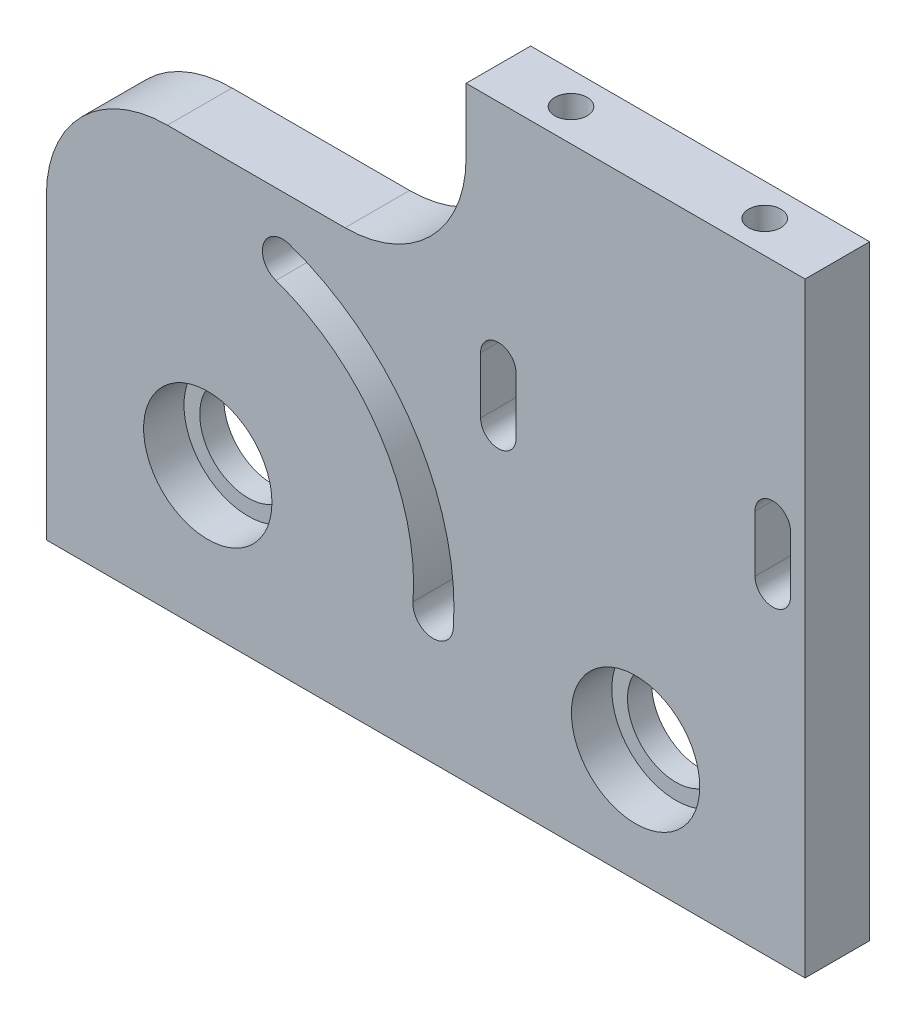
from build123d import *

# Parameters (mm, degrees)
ESQUISSE1_W             = 114.432989691
ESQUISSE1_H             = 75
BOSS_EXTRU_1_DEPTH      = 8
ESQUISSE2_R             = 7.95
ENL_V_MAT_EXTRU_1_DEPTH = 5
ENL_V_MAT_EXTRU_2_REACH = 138.912
ESQUISSE3_R             = 6
ENL_V_MAT_EXTRU_3_DEPTH = 138.05440208
ESQUISSE5_W             = 20.432989691
ESQUISSE5_H             = 75
ENL_V_MAT_EXTRU_4_DEPTH = 138.05440208
ENL_V_MAT_EXTRU_5_DEPTH = 121.519707932
ESQUISSE7_W             = 52
ESQUISSE7_H             = 23
ENL_V_MAT_EXTRU_6_DEPTH = 121.519707932
ESQUISSE10_R            = 2
ENL_V_MAT_EXTRU_7_DEPTH = 30
CONG_1_R                = 15
ESQUISSE11_R            = 2
ENL_V_MAT_EXTRU_8_DEPTH = 20


with BuildPart() as part:
    # Esquisse1 → Boss.-Extru.1 (new body)
    with BuildSketch(Plane.XY):
        with Locations((57.216494846, 37.5)):
            Rectangle(ESQUISSE1_W, ESQUISSE1_H)
    extrude(amount=BOSS_EXTRU_1_DEPTH)

    # Esquisse2 → Enlèv. mat.-Extru.1 (cut)
    with BuildSketch(Plane.XY.offset(8)):
        with Locations((20, 18)):
            Circle(ESQUISSE2_R)
        with Locations((73, 14)):
            Circle(ESQUISSE2_R)
    extrude(amount=-ENL_V_MAT_EXTRU_1_DEPTH, mode=Mode.SUBTRACT)

    # Esquisse3 → Enlèv. mat.-Extru.2 (cut, up to next)
    with BuildSketch(Plane.XY.offset(3), mode=Mode.PRIVATE) as enl_v_mat_extru_2_sk1:
        with Locations((20, 18)):
            Circle(ESQUISSE3_R)
    enl_v_mat_extru_2_tool1 = extrude(enl_v_mat_extru_2_sk1.sketch, amount=-ENL_V_MAT_EXTRU_2_REACH, mode=Mode.PRIVATE) & part.part
    # Esquisse3 → Enlèv. mat.-Extru.2 (cut, up to next)
    with BuildSketch(Plane.XY.offset(3), mode=Mode.PRIVATE) as enl_v_mat_extru_2_sk2:
        with Locations((73, 14)):
            Circle(ESQUISSE3_R)
    enl_v_mat_extru_2_tool2 = extrude(enl_v_mat_extru_2_sk2.sketch, amount=-ENL_V_MAT_EXTRU_2_REACH, mode=Mode.PRIVATE) & part.part
    add(enl_v_mat_extru_2_tool1.solids().sort_by_distance((20, 18, 3))[0], mode=Mode.SUBTRACT)
    add(enl_v_mat_extru_2_tool2.solids().sort_by_distance((73, 14, 3))[0], mode=Mode.SUBTRACT)

    # Esquisse4 → Enlèv. mat.-Extru.3 (cut, through all)
    with BuildSketch(Plane.XY.offset(8)):
        with BuildLine():
            ThreePointArc((50.413505675, 15.704641081), (45.525982293, 34.69353851), (30.088740957, 46.783107996))
            ThreePointArc((30.088740957, 46.783107996), (26.90252383, 45.250782829), (28.434848997, 42.064565701))
            ThreePointArc((28.434848997, 42.064565701), (41.341395032, 31.956892853), (45.427685072, 16.080929428))
            ThreePointArc((45.427685072, 16.080929428), (47.7324512, 13.399874954), (50.413505675, 15.704641081))
        make_face()
    extrude(amount=-ENL_V_MAT_EXTRU_3_DEPTH, mode=Mode.SUBTRACT)

    # Esquisse5 → Enlèv. mat.-Extru.4 (cut, through all)
    with BuildSketch(Plane.XY.offset(8)):
        with Locations((104.216494845, 37.5)):
            Rectangle(ESQUISSE5_W, ESQUISSE5_H)
    extrude(amount=-ENL_V_MAT_EXTRU_4_DEPTH, mode=Mode.SUBTRACT)

    # Esquisse6 → Enlèv. mat.-Extru.5 (cut, through all)
    with BuildSketch(Plane.XY.offset(8)):
        with BuildLine():
            Line((87.8, 40), (87.8, 47))
            ThreePointArc((87.8, 47), (90, 49.2), (92.2, 47))
            Line((92.2, 47), (92.2, 40))
            ThreePointArc((92.2, 40), (90, 37.8), (87.8, 40))
        make_face()
        with BuildLine():
            Line((58.2, 40), (58.2, 47))
            ThreePointArc((58.2, 47), (56, 49.2), (53.8, 47))
            Line((53.8, 47), (53.8, 40))
            ThreePointArc((53.8, 40), (56, 37.8), (58.2, 40))
        make_face()
    extrude(amount=-ENL_V_MAT_EXTRU_5_DEPTH, mode=Mode.SUBTRACT)

    # Esquisse7 → Enlèv. mat.-Extru.6 (cut, through all)
    with BuildSketch(Plane.XY.offset(8)):
        with Locations((26, 63.5)):
            Rectangle(ESQUISSE7_W, ESQUISSE7_H)
    extrude(amount=-ENL_V_MAT_EXTRU_6_DEPTH, mode=Mode.SUBTRACT)

    # Esquisse10 → Enlèv. mat.-Extru.7 (cut)
    with BuildSketch(Plane(origin=(0, 75, 0), x_dir=(1, 0, 0), z_dir=(0, 1, 0))):
        with Locations((85, -4)):
            Circle(ESQUISSE10_R)
        with Locations((61, -4)):
            Circle(ESQUISSE10_R)
    extrude(amount=-ENL_V_MAT_EXTRU_7_DEPTH, mode=Mode.SUBTRACT)

    # Congé1
    cong_1_edges = [part.edges().sort_by_distance(p)[0] for p in [
        (52, 52, 4),
        (0, 52, 4),
    ]]
    fillet(cong_1_edges, radius=CONG_1_R)

    # Esquisse11 → Enlèv. mat.-Extru.8 (cut)
    with BuildSketch(Plane.XZ):
        with Locations((6, 4)):
            Circle(ESQUISSE11_R)
        with Locations((88, 4)):
            Circle(ESQUISSE11_R)
    extrude(amount=-ENL_V_MAT_EXTRU_8_DEPTH, mode=Mode.SUBTRACT)


solid = part.part
